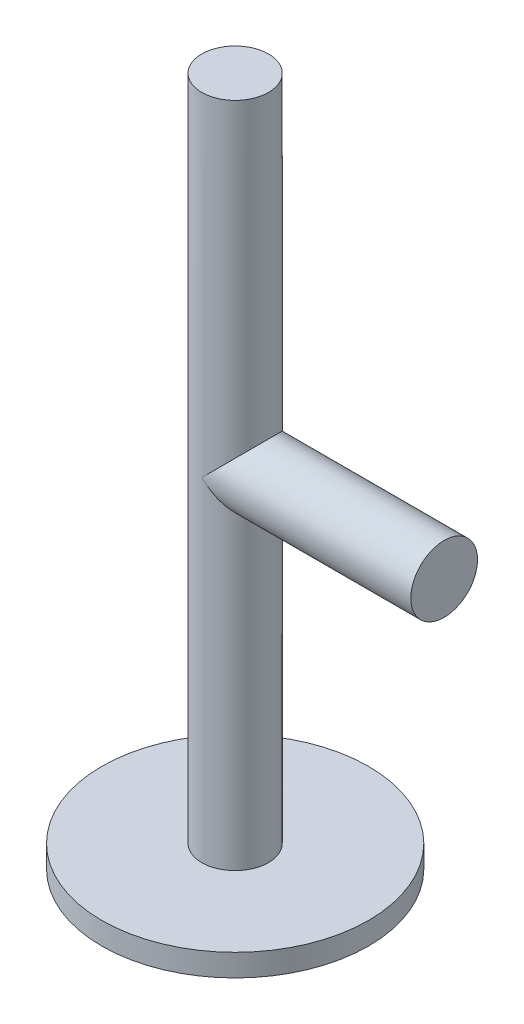
from build123d import *

# Parameters (mm, degrees)
SKETCH1_R           = 7.5
BOSS_EXTRUDE1_DEPTH = 150
SKETCH2_R           = 30
BOSS_EXTRUDE2_DEPTH = 5
SKETCH5_R           = 7.5
BOSS_EXTRUDE3_DEPTH = 47


with BuildPart() as part:
    # Sketch1 → Boss-Extrude1 (new body)
    with BuildSketch(Plane(origin=(0, 0, 0), x_dir=(1, 0, 0), z_dir=(0, 1, 0))):
        Circle(SKETCH1_R)
    extrude(amount=BOSS_EXTRUDE1_DEPTH)

    # Sketch2 → Boss-Extrude2 (add)
    with BuildSketch(Plane.XZ):
        Circle(SKETCH2_R)
    extrude(amount=BOSS_EXTRUDE2_DEPTH)

    # Sketch5 → Boss-Extrude3 (add)
    with BuildSketch(Plane(origin=(0, 0, 0), x_dir=(0, 0, -1), z_dir=(1, 0, 0))):
        with Locations((0, 75)):
            Circle(SKETCH5_R)
    extrude(amount=BOSS_EXTRUDE3_DEPTH)


solid = part.part
